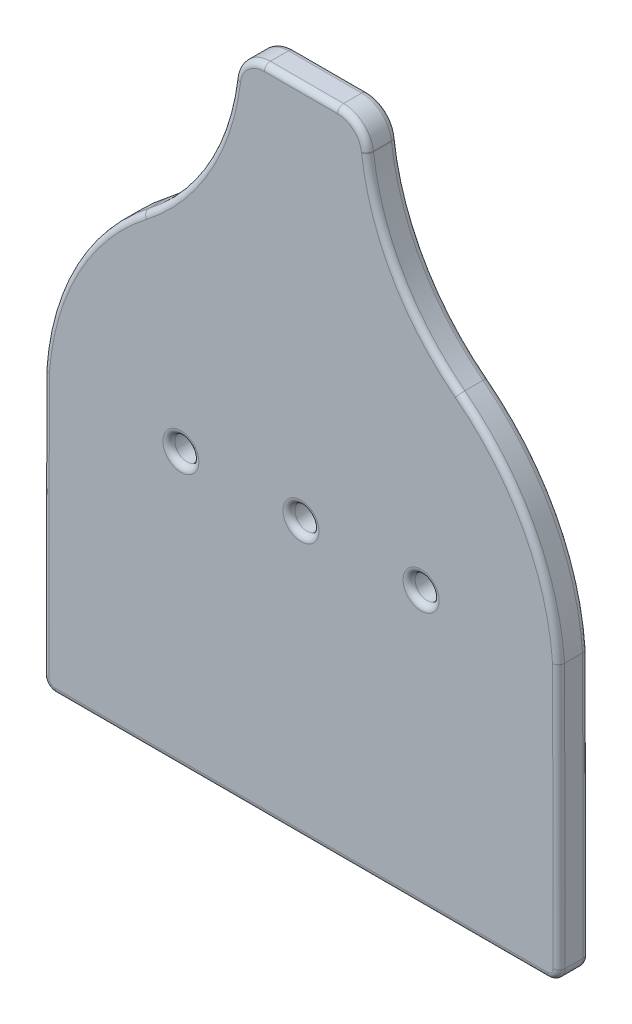
from build123d import *

# Parameters (mm, degrees)
BOSS_EXTRUDE1_DEPTH = 2.5
SKETCH3_R           = 1
CUT_EXTRUDE1_DEPTH  = 2.5
FILLET1_R           = 1
FILLET2_R           = 0.5
FILLET3_R           = 0.5


with BuildPart() as part:
    # Sketch2 → Boss-Extrude1 (new body)
    with BuildSketch(Plane.XY):
        with BuildLine():
            Line((-21.447614762, 11.499940343), (-21.5, -11.5))
            Line((-21.5, -11.5), (21.5, -11.5))
            Line((21.5, -11.5), (21.447614762, 11.499940343))
            ThreePointArc((21.447614762, 11.499940343), (18.95861031, 20.140073724), (13.153764478, 27.006718674))
            ThreePointArc((13.153764478, 27.006718674), (7.998527865, 32.950546095), (5.534835658, 40.422879711))
            Line((5.534835658, 40.422879711), (5.529472751, 40.467171964))
            ThreePointArc((5.529472751, 40.467171964), (4.705721094, 42.037664161), (3.047599151, 42.666666667))
            Line((3.047599151, 42.666666667), (-3.047599151, 42.666666667))
            ThreePointArc((-3.047599151, 42.666666667), (-4.705721094, 42.037664161), (-5.529472751, 40.467171964))
            Line((-5.529472751, 40.467171964), (-5.534835658, 40.422879711))
            ThreePointArc((-5.534835658, 40.422879711), (-7.998527865, 32.950546095), (-13.153764478, 27.006718674))
            ThreePointArc((-13.153764478, 27.006718674), (-18.95861031, 20.140073724), (-21.447614762, 11.499940343))
        make_face()
    extrude(amount=BOSS_EXTRUDE1_DEPTH)

    # Sketch3 → Cut-Extrude1 (cut)
    with BuildSketch(Plane.XY.offset(2.5)):
        with Locations((0, 11.301150259)):
            Circle(SKETCH3_R)
        with Locations((10, 11.301150259)):
            Circle(SKETCH3_R)
        with Locations((-10, 11.301150259)):
            Circle(SKETCH3_R)
    extrude(amount=-CUT_EXTRUDE1_DEPTH, mode=Mode.SUBTRACT)

    # Fillet1
    fillet1_edges = [part.edges().sort_by_distance(p)[0] for p in [
        (21.5, -11.5, 1.25),
        (-21.5, -11.5, 1.25),
    ]]
    fillet(fillet1_edges, radius=FILLET1_R)

    # Fillet2
    # the kernel refuses this fillet: 0.5 mm, written as the material it takes off along each edge
    with BuildSketch(Plane(origin=(0, 10, 2.5), x_dir=(-0.6118029989647665, 0.7910101708939764, 0), z_dir=(0.7910101708939764, 0.6118029989647665, 0))) as fillet2_piece_1:
        with BuildLine():
            CenterArc((21.5 - FILLET2_R, -FILLET2_R), FILLET2_R, 0, 90)
            Line((21.5 - FILLET2_R, 0), (21.5, 0))
            Line((21.5, 0), (21.5, -FILLET2_R))
        make_face()
    revolve(axis=Axis((0, 10, 2.5), (0, 0, 1)), revolution_arc=51.611078363, mode=Mode.SUBTRACT)
    with BuildSketch(Plane(origin=(-21.444767738, 12.749937101, 2.5), x_dir=(0, 0, -1), z_dir=(-0.0022776190557038953, -0.9999974062223548, 0))) as fillet2_piece_2:
        with BuildLine():
            CenterArc((FILLET2_R, FILLET2_R), FILLET2_R, 180, 90)
            Line((0, FILLET2_R), (0, 0))
            Line((0, 0), (FILLET2_R, 0))
        make_face()
    extrude(amount=23.247719781, mode=Mode.SUBTRACT)
    with BuildSketch(Plane(origin=(21.497717187, -10.497722381, 2.5), x_dir=(-0.9999974062223547, -0.002277619055703895, 0), z_dir=(-0.0022776190557038953, 0.9999974062223548, 0))) as fillet2_piece_3:
        with BuildLine():
            CenterArc((FILLET2_R, -FILLET2_R), FILLET2_R, 90, 90)
            Line((0, -FILLET2_R), (0, 0))
            Line((0, 0), (FILLET2_R, 0))
        make_face()
    extrude(amount=23.247719781, mode=Mode.SUBTRACT)
    with BuildSketch(Plane(origin=(0, 10, 2.5), x_dir=(0.999931846454531, 0.011674863854978535, 0), z_dir=(0.011674863854978535, -0.999931846454531, 0))) as fillet2_piece_4:
        with BuildLine():
            CenterArc((21.5 - FILLET2_R, -FILLET2_R), FILLET2_R, 0, 90)
            Line((21.5, -FILLET2_R), (21.5, 0))
            Line((21.5, 0), (21.5 - FILLET2_R, 0))
        make_face()
    revolve(axis=Axis((0, 10, 2.5), (0, 0, 1)), revolution_arc=51.611078363, mode=Mode.SUBTRACT)
    with BuildSketch(Plane(origin=(25.389824457, 42.826922092, 2.5), x_dir=(-0.6118029989647666, -0.7910101708939764, 0), z_dir=(0.7910101708939764, -0.6118029989647666, 0))) as fillet2_piece_5:
        with BuildLine():
            CenterArc((20 + FILLET2_R, FILLET2_R), FILLET2_R, 180, 90)
            Line((20, FILLET2_R), (20, 0))
            Line((20, 0), (20 + FILLET2_R, 0))
        make_face()
    revolve(axis=Axis((25.389824457, 42.826922092, 2.5), (0, 0, -1)), revolution_arc=45.3762464, mode=Mode.SUBTRACT)
    with BuildSketch(Plane(origin=(5.534835658, 40.422879711, 2.5), x_dir=(-0.9927494399740624, -0.12020211907943115, 0), z_dir=(-0.12020211907943114, 0.9927494399740623, 0)), Plane(origin=(-5.529472751, 40.467171964, 2.5), x_dir=(0.9927494399740623, -0.1202021190794305, 0), z_dir=(-0.12020211907943051, -0.9927494399740624, 0))) as fillet2_piece_6:
        with BuildLine():
            CenterArc((FILLET2_R, -FILLET2_R), FILLET2_R, 90, 90)
            Line((0, -FILLET2_R), (0, 0))
            Line((0, 0), (FILLET2_R, 0))
        make_face()
    extrude(amount=0.044615743, mode=Mode.SUBTRACT)
    with BuildSketch(Plane(origin=(-10, 11.301150259, 2.5), x_dir=(1, 0, 0), z_dir=(0, -1, 0))) as fillet2_piece_7:
        with BuildLine():
            CenterArc((1 + FILLET2_R, -FILLET2_R), FILLET2_R, 90, 90)
            Line((1, -FILLET2_R), (1, 0))
            Line((1, 0), (1 + FILLET2_R, 0))
        make_face()
    revolve(axis=Axis((-10, 11.301150259, 2.5), (0, 0, 1)), mode=Mode.SUBTRACT)
    with BuildSketch(Plane(origin=(10, 11.301150259, 2.5), x_dir=(1, 0, 0), z_dir=(0, -1, 0))) as fillet2_piece_8:
        with BuildLine():
            CenterArc((1 + FILLET2_R, -FILLET2_R), FILLET2_R, 90, 90)
            Line((1, -FILLET2_R), (1, 0))
            Line((1, 0), (1 + FILLET2_R, 0))
        make_face()
    revolve(axis=Axis((10, 11.301150259, 2.5), (0, 0, 1)), mode=Mode.SUBTRACT)
    with BuildSketch(Plane(origin=(3.047599151, 40.166666667, 2.5), x_dir=(0.9927494399740617, 0.12020211907943634, 0), z_dir=(0.12020211907943634, -0.9927494399740617, 0))) as fillet2_piece_9:
        with BuildLine():
            CenterArc((2.5 - FILLET2_R, -FILLET2_R), FILLET2_R, 0, 90)
            Line((2.5, -FILLET2_R), (2.5, 0))
            Line((2.5, 0), (2.5 - FILLET2_R, 0))
        make_face()
    revolve(axis=Axis((3.047599151, 40.166666667, 2.5), (0, 0, 1)), revolution_arc=83.096232415, mode=Mode.SUBTRACT)
    with BuildSketch(Plane(origin=(0, 11.301150259, 2.5), x_dir=(1, 0, 0), z_dir=(0, -1, 0))) as fillet2_piece_10:
        with BuildLine():
            CenterArc((1 + FILLET2_R, -FILLET2_R), FILLET2_R, 90, 90)
            Line((1, -FILLET2_R), (1, 0))
            Line((1, 0), (1 + FILLET2_R, 0))
        make_face()
    revolve(axis=Axis((0, 11.301150259, 2.5), (0, 0, 1)), mode=Mode.SUBTRACT)
    with BuildSketch(Plane(origin=(3.047599151, 42.666666667, 2.5), x_dir=(0, -1, 0), z_dir=(-1, 0, 0))) as fillet2_piece_11:
        with BuildLine():
            CenterArc((FILLET2_R, -FILLET2_R), FILLET2_R, 90, 90)
            Line((0, -FILLET2_R), (0, 0))
            Line((0, 0), (FILLET2_R, 0))
        make_face()
    extrude(amount=6.095198302, mode=Mode.SUBTRACT)
    with BuildSketch(Plane(origin=(-20.497719781, -11.5, 2.5), x_dir=(0, 1, 0), z_dir=(1, 0, 0))) as fillet2_piece_12:
        with BuildLine():
            CenterArc((FILLET2_R, -FILLET2_R), FILLET2_R, 90, 90)
            Line((0, -FILLET2_R), (0, 0))
            Line((0, 0), (FILLET2_R, 0))
        make_face()
    extrude(amount=40.995439563, mode=Mode.SUBTRACT)
    with BuildSketch(Plane(origin=(-3.047599151, 40.166666667, 2.5), x_dir=(0, 1, 0), z_dir=(1, 0, 0))) as fillet2_piece_13:
        with BuildLine():
            CenterArc((2.5 - FILLET2_R, -FILLET2_R), FILLET2_R, 0, 90)
            Line((2.5, -FILLET2_R), (2.5, 0))
            Line((2.5, 0), (2.5 - FILLET2_R, 0))
        make_face()
    revolve(axis=Axis((-3.047599151, 40.166666667, 2.5), (0, 0, 1)), revolution_arc=83.096232415, mode=Mode.SUBTRACT)
    with BuildSketch(Plane(origin=(20.497719781, -10.5, 2.5), x_dir=(0, -1, 0), z_dir=(-1, 0, 0))) as fillet2_piece_14:
        with BuildLine():
            CenterArc((1 - FILLET2_R, -FILLET2_R), FILLET2_R, 0, 90)
            Line((1, -FILLET2_R), (1, 0))
            Line((1, 0), (1 - FILLET2_R, 0))
        make_face()
    revolve(axis=Axis((20.497719781, -10.5, 2.5), (0, 0, 1)), revolution_arc=90.130498072, mode=Mode.SUBTRACT)
    with BuildSketch(Plane(origin=(-20.497719781, -10.5, 2.5), x_dir=(-0.9999974062223547, 0.002277619055705668, 0), z_dir=(0.002277619055705668, 0.9999974062223547, 0))) as fillet2_piece_15:
        with BuildLine():
            CenterArc((1 - FILLET2_R, -FILLET2_R), FILLET2_R, 0, 90)
            Line((1 - FILLET2_R, 0), (1, 0))
            Line((1, 0), (1, -FILLET2_R))
        make_face()
    revolve(axis=Axis((-20.497719781, -10.5, 2.5), (0, 0, 1)), revolution_arc=90.130498072, mode=Mode.SUBTRACT)
    with BuildSketch(Plane(origin=(-25.389824457, 42.826922092, 2.5), x_dir=(0.9927494399740615, -0.12020211907943686, 0), z_dir=(0.12020211907943686, 0.9927494399740615, 0))) as fillet2_piece_16:
        with BuildLine():
            CenterArc((20 + FILLET2_R, FILLET2_R), FILLET2_R, 180, 90)
            Line((20, FILLET2_R), (20, 0))
            Line((20, 0), (20 + FILLET2_R, 0))
        make_face()
    revolve(axis=Axis((-25.389824457, 42.826922092, 2.5), (0, 0, -1)), revolution_arc=45.3762464, mode=Mode.SUBTRACT)

    # Fillet3
    # the kernel refuses this fillet: 0.5 mm, written as the material it takes off along each edge
    with BuildSketch(Plane(origin=(-3.047599151, 40.166666667, 0), x_dir=(0, 1, 0), z_dir=(1, 0, 0))) as fillet3_piece_1:
        with BuildLine():
            CenterArc((2.5 - FILLET3_R, FILLET3_R), FILLET3_R, 270, 90)
            Line((2.5, FILLET3_R), (2.5, 0))
            Line((2.5, 0), (2.5 - FILLET3_R, 0))
        make_face()
    revolve(axis=Axis((-3.047599151, 40.166666667, 0), (0, 0, 1)), revolution_arc=83.096232415, mode=Mode.SUBTRACT)
    with BuildSketch(Plane(origin=(3.047599151, 42.666666667, 0), x_dir=(0, -1, 0), z_dir=(-1, 0, 0))) as fillet3_piece_2:
        with BuildLine():
            CenterArc((FILLET3_R, FILLET3_R), FILLET3_R, 180, 90)
            Line((0, FILLET3_R), (0, 0))
            Line((0, 0), (FILLET3_R, 0))
        make_face()
    extrude(amount=6.095198302, mode=Mode.SUBTRACT)
    with BuildSketch(Plane(origin=(3.047599151, 40.166666667, 0), x_dir=(0.9927494399740617, 0.12020211907943634, 0), z_dir=(0.12020211907943634, -0.9927494399740617, 0))) as fillet3_piece_3:
        with BuildLine():
            CenterArc((2.5 - FILLET3_R, FILLET3_R), FILLET3_R, 270, 90)
            Line((2.5, FILLET3_R), (2.5, 0))
            Line((2.5, 0), (2.5 - FILLET3_R, 0))
        make_face()
    revolve(axis=Axis((3.047599151, 40.166666667, 0), (0, 0, 1)), revolution_arc=83.096232415, mode=Mode.SUBTRACT)
    with BuildSketch(Plane(origin=(5.534835658, 40.422879711, 0), x_dir=(-0.9927494399740624, -0.12020211907943115, 0), z_dir=(-0.12020211907943114, 0.9927494399740623, 0)), Plane(origin=(-5.529472751, 40.467171964, 0), x_dir=(0.9927494399740623, -0.1202021190794305, 0), z_dir=(-0.12020211907943051, -0.9927494399740624, 0))) as fillet3_piece_4:
        with BuildLine():
            CenterArc((FILLET3_R, FILLET3_R), FILLET3_R, 180, 90)
            Line((0, FILLET3_R), (0, 0))
            Line((0, 0), (FILLET3_R, 0))
        make_face()
    extrude(amount=0.044615743, mode=Mode.SUBTRACT)
    with BuildSketch(Plane(origin=(25.389824457, 42.826922092, 0), x_dir=(-0.6118029989647666, -0.7910101708939764, 0), z_dir=(0.7910101708939764, -0.6118029989647666, 0))) as fillet3_piece_5:
        with BuildLine():
            CenterArc((20 + FILLET3_R, -FILLET3_R), FILLET3_R, 90, 90)
            Line((20, -FILLET3_R), (20, 0))
            Line((20, 0), (20 + FILLET3_R, 0))
        make_face()
    revolve(axis=Axis((25.389824457, 42.826922092, 0), (0, 0, -1)), revolution_arc=45.3762464, mode=Mode.SUBTRACT)
    with BuildSketch(Plane(origin=(0, 10, 0), x_dir=(0.999931846454531, 0.011674863854978535, 0), z_dir=(0.011674863854978535, -0.999931846454531, 0))) as fillet3_piece_6:
        with BuildLine():
            CenterArc((21.5 - FILLET3_R, FILLET3_R), FILLET3_R, 270, 90)
            Line((21.5, FILLET3_R), (21.5, 0))
            Line((21.5, 0), (21.5 - FILLET3_R, 0))
        make_face()
    revolve(axis=Axis((0, 10, 0), (0, 0, 1)), revolution_arc=51.611078363, mode=Mode.SUBTRACT)
    with BuildSketch(Plane(origin=(21.497717187, -10.497722381, 0), x_dir=(-0.9999974062223547, -0.002277619055703895, 0), z_dir=(-0.0022776190557038953, 0.9999974062223548, 0))) as fillet3_piece_7:
        with BuildLine():
            CenterArc((FILLET3_R, FILLET3_R), FILLET3_R, 180, 90)
            Line((0, FILLET3_R), (0, 0))
            Line((0, 0), (FILLET3_R, 0))
        make_face()
    extrude(amount=23.247719781, mode=Mode.SUBTRACT)
    with BuildSketch(Plane(origin=(-21.444767738, 12.749937101, 0), x_dir=(0, 0, 1), z_dir=(-0.0022776190557038953, -0.9999974062223548, 0))) as fillet3_piece_8:
        with BuildLine():
            CenterArc((FILLET3_R, -FILLET3_R), FILLET3_R, 90, 90)
            Line((0, -FILLET3_R), (0, 0))
            Line((0, 0), (FILLET3_R, 0))
        make_face()
    extrude(amount=23.247719781, mode=Mode.SUBTRACT)
    with BuildSketch(Plane(origin=(0, 10, 0), x_dir=(-0.6118029989647665, 0.7910101708939764, 0), z_dir=(0.7910101708939764, 0.6118029989647665, 0))) as fillet3_piece_9:
        with BuildLine():
            CenterArc((21.5 - FILLET3_R, FILLET3_R), FILLET3_R, 270, 90)
            Line((21.5 - FILLET3_R, 0), (21.5, 0))
            Line((21.5, 0), (21.5, FILLET3_R))
        make_face()
    revolve(axis=Axis((0, 10, 0), (0, 0, 1)), revolution_arc=51.611078363, mode=Mode.SUBTRACT)
    with BuildSketch(Plane(origin=(-25.389824457, 42.826922092, 0), x_dir=(0.9927494399740615, -0.12020211907943686, 0), z_dir=(0.12020211907943686, 0.9927494399740615, 0))) as fillet3_piece_10:
        with BuildLine():
            CenterArc((20 + FILLET3_R, -FILLET3_R), FILLET3_R, 90, 90)
            Line((20, -FILLET3_R), (20, 0))
            Line((20, 0), (20 + FILLET3_R, 0))
        make_face()
    revolve(axis=Axis((-25.389824457, 42.826922092, 0), (0, 0, -1)), revolution_arc=45.3762464, mode=Mode.SUBTRACT)
    with BuildSketch(Plane(origin=(-10, 11.301150259, 0), x_dir=(1, 0, 0), z_dir=(0, -1, 0))) as fillet3_piece_11:
        with BuildLine():
            CenterArc((1 + FILLET3_R, FILLET3_R), FILLET3_R, 180, 90)
            Line((1, FILLET3_R), (1, 0))
            Line((1, 0), (1 + FILLET3_R, 0))
        make_face()
    revolve(axis=Axis((-10, 11.301150259, 0), (0, 0, 1)), mode=Mode.SUBTRACT)
    with BuildSketch(Plane(origin=(10, 11.301150259, 0), x_dir=(1, 0, 0), z_dir=(0, -1, 0))) as fillet3_piece_12:
        with BuildLine():
            CenterArc((1 + FILLET3_R, FILLET3_R), FILLET3_R, 180, 90)
            Line((1, FILLET3_R), (1, 0))
            Line((1, 0), (1 + FILLET3_R, 0))
        make_face()
    revolve(axis=Axis((10, 11.301150259, 0), (0, 0, 1)), mode=Mode.SUBTRACT)
    with BuildSketch(Plane(origin=(0, 11.301150259, 0), x_dir=(1, 0, 0), z_dir=(0, -1, 0))) as fillet3_piece_13:
        with BuildLine():
            CenterArc((1 + FILLET3_R, FILLET3_R), FILLET3_R, 180, 90)
            Line((1, FILLET3_R), (1, 0))
            Line((1, 0), (1 + FILLET3_R, 0))
        make_face()
    revolve(axis=Axis((0, 11.301150259, 0), (0, 0, 1)), mode=Mode.SUBTRACT)
    with BuildSketch(Plane(origin=(-20.497719781, -11.5, 0), x_dir=(0, 1, 0), z_dir=(1, 0, 0))) as fillet3_piece_14:
        with BuildLine():
            CenterArc((FILLET3_R, FILLET3_R), FILLET3_R, 180, 90)
            Line((0, FILLET3_R), (0, 0))
            Line((0, 0), (FILLET3_R, 0))
        make_face()
    extrude(amount=40.995439563, mode=Mode.SUBTRACT)
    with BuildSketch(Plane(origin=(20.497719781, -10.5, 0), x_dir=(0, -1, 0), z_dir=(-1, 0, 0))) as fillet3_piece_15:
        with BuildLine():
            CenterArc((1 - FILLET3_R, FILLET3_R), FILLET3_R, 270, 90)
            Line((1, FILLET3_R), (1, 0))
            Line((1, 0), (1 - FILLET3_R, 0))
        make_face()
    revolve(axis=Axis((20.497719781, -10.5, 0), (0, 0, 1)), revolution_arc=90.130498072, mode=Mode.SUBTRACT)
    with BuildSketch(Plane(origin=(-20.497719781, -10.5, 0), x_dir=(-0.9999974062223547, 0.002277619055705668, 0), z_dir=(0.002277619055705668, 0.9999974062223547, 0))) as fillet3_piece_16:
        with BuildLine():
            CenterArc((1 - FILLET3_R, FILLET3_R), FILLET3_R, 270, 90)
            Line((1 - FILLET3_R, 0), (1, 0))
            Line((1, 0), (1, FILLET3_R))
        make_face()
    revolve(axis=Axis((-20.497719781, -10.5, 0), (0, 0, 1)), revolution_arc=90.130498072, mode=Mode.SUBTRACT)


solid = part.part
